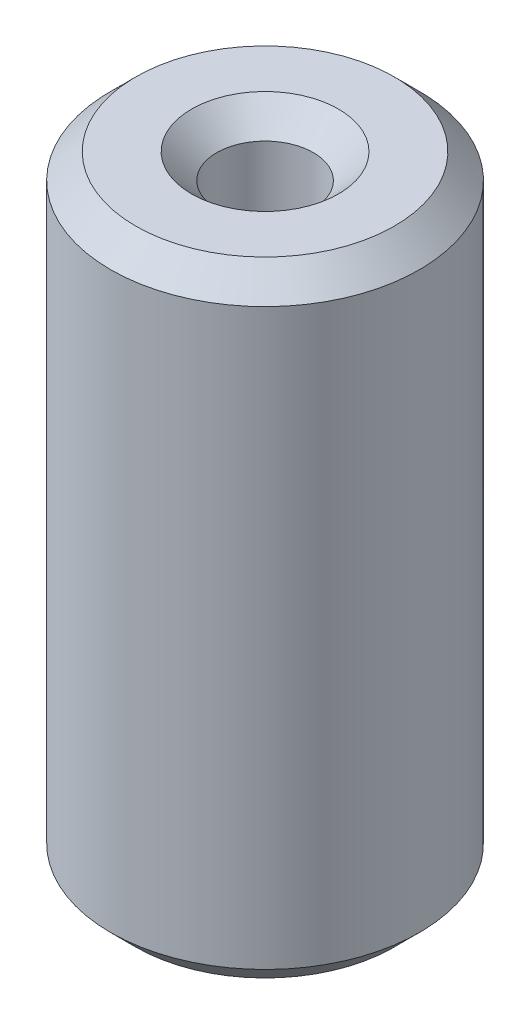
from build123d import *

# Parameters (mm, degrees)
SKETCH1_R           = 5
BOSS_EXTRUDE1_DEPTH = 20.213058363
SKETCH2_R           = 1.565795172
CUT_EXTRUDE1_DEPTH  = 22.414194554
CHAMFER1_SIZE       = 0.814275141


with BuildPart() as part:
    # Sketch1 → Boss-Extrude1 (new body)
    with BuildSketch(Plane(origin=(0, 0, 0), x_dir=(1, 0, 0), z_dir=(0, 1, 0))):
        Circle(SKETCH1_R)
    extrude(amount=BOSS_EXTRUDE1_DEPTH)

    # Sketch2 → Cut-Extrude1 (cut, through all)
    with BuildSketch(Plane(origin=(0, 0, 0), x_dir=(1, 0, 0), z_dir=(0, 1, 0))):
        Circle(SKETCH2_R)
    extrude(amount=CUT_EXTRUDE1_DEPTH, mode=Mode.SUBTRACT)

    # Chamfer1
    chamfer1_edges = [part.edges().sort_by_distance(p)[0] for p in [
        (-1.565795172, 20.213058363, 0),
        (-1.565795172, 0, 0),
        (-5, 0, 0),
        (-5, 20.213058363, 0),
    ]]
    chamfer(chamfer1_edges, length=CHAMFER1_SIZE)


solid = part.part
